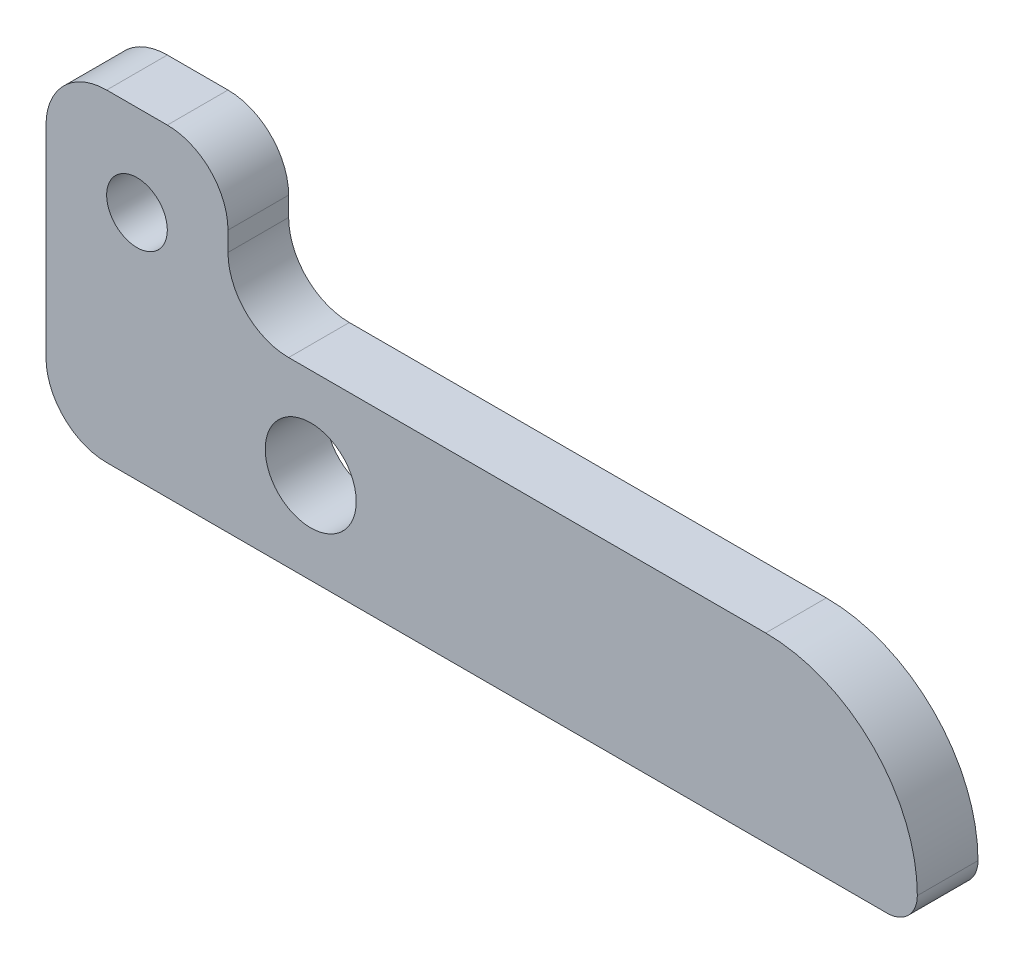
from build123d import *

# Parameters (mm, degrees)
SKETCH1_R           = 1.5
SKETCH1_R_2         = 1
BOSS_EXTRUDE1_DEPTH = 2
FILLET7_R           = 5
FILLET8_R           = 1
FILLET9_R           = 2


with BuildPart() as part:
    # Sketch1 → Boss-Extrude1 (new body)
    with BuildSketch(Plane.XY):
        Polygon((-2.167750967, 169.712259216), (-2.167750967, 174.350350498), (-8.167750967, 174.350350498), (-8.167750967, 163.712259216), (0.596545219, 163.712259216), (20.559814769, 163.712259216), (20.559814769, 169.712259216), align=None)
        with Locations((0.559814769, 166.712259216)):
            Circle(SKETCH1_R, mode=Mode.SUBTRACT)
        with Locations((-5.167750967, 171.350350498)):
            Circle(SKETCH1_R_2, mode=Mode.SUBTRACT)
    extrude(amount=BOSS_EXTRUDE1_DEPTH)

    # Fillet7
    fillet7_edges = [part.edges().sort_by_distance(p)[0] for p in [
        (20.559814769, 169.712259216, 1),
    ]]
    fillet(fillet7_edges, radius=FILLET7_R)

    # Fillet8
    fillet8_edges = [part.edges().sort_by_distance(p)[0] for p in [
        (20.559814769, 163.712259216, 1),
    ]]
    fillet(fillet8_edges, radius=FILLET8_R - 0.0001)  # a hair under: the kernel refuses the full size

    # Fillet9
    fillet9_edges = [part.edges().sort_by_distance(p)[0] for p in [
        (-8.167750967, 174.350350498, 1),
        (-2.167750967, 174.350350498, 1),
        (-2.167750967, 169.712259216, 1),
        (-8.167750967, 163.712259216, 1),
    ]]
    fillet(fillet9_edges, radius=FILLET9_R)


solid = part.part
